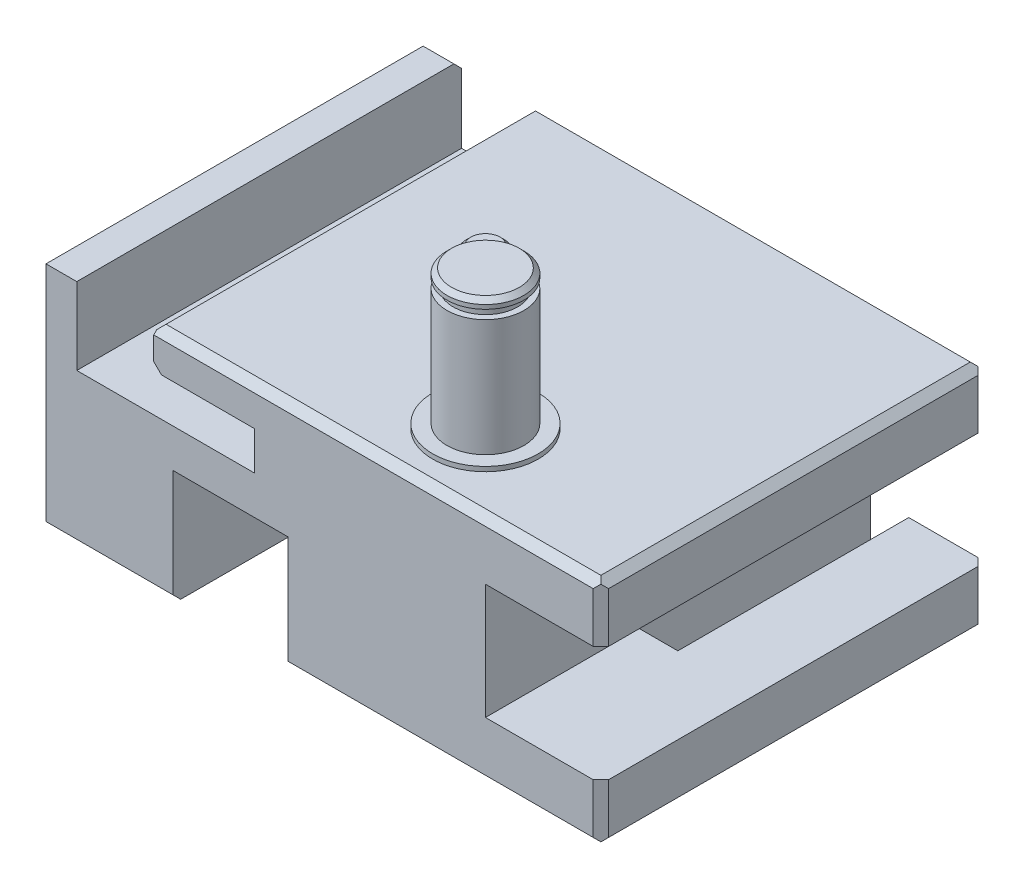
from build123d import *

# Parameters (mm, degrees)
BOSS_EXTRUDE1_DEPTH  = 31.75
CUT_EXTRUDE2_DEPTH   = 57.92947648
CUT_EXTRUDE1_DEPTH   = 57.92947648
FILLET1_R            = 2.54
CHAMFER1_SIZE        = 0.635
SKETCH5_R            = 4.3561
BOSS_EXTRUDE3_DEPTH  = 0.381
SKETCH6_R            = 3.175
BOSS_EXTRUDE4_DEPTH  = 11.1125
CHAMFER7_SIZE        = 0.381
CUT_EXTRUDE3_DEPTH   = 57.92947648
SKETCH12_W           = 19.05
SKETCH12_H           = 19.05
BOSS_EXTRUDE9_DEPTH  = 31.75
CUT_EXTRUDE4_DEPTH   = 62.733039651
CHAMFER6_SIZE        = 0.635
SKETCH16_W           = 1.016
SKETCH16_H           = 0.7366
SKETCH7_R            = 1.5875
BOSS_EXTRUDE11_DEPTH = 6.35
CHAMFER9_SIZE        = 0.381
SKETCH18_W           = 3.81
SKETCH18_H           = 3.81
BOSS_EXTRUDE12_DEPTH = 12.7
BOSS_EXTRUDE13_DEPTH = 0.635
CHAMFER10_SIZE       = 0.889
CHAMFER10_SIZE2      = 0.622484501
SKETCH20_W           = 3.175
SKETCH20_H           = 19.05
BOSS_EXTRUDE14_DEPTH = 31.75


with BuildPart() as part:
    # Sketch1 → Boss-Extrude1 (new body)
    with BuildSketch(Plane.XY):
        Polygon((0, 0), (7.9375, 0), (7.9375, 6.35), (4.7498, 6.35), (4.7498, 9.525), (20.6248, 9.525), (20.6248, 6.35), (17.4371, 6.35), (17.4371, 0), (43.2435, 0), (43.2435, 19.05), (0, 19.05), align=None)
    extrude(amount=BOSS_EXTRUDE1_DEPTH)

    # Sketch3 → Cut-Extrude2 (cut, through all)
    with BuildSketch(Plane.XY):
        Polygon((6.35, 15.875), (14.6685, 15.875), (14.6685, 12.7), (0, 12.7), (0, 19.05), (6.35, 19.05), align=None)
    extrude(amount=CUT_EXTRUDE2_DEPTH, mode=Mode.SUBTRACT)

    # Sketch2 → Cut-Extrude1 (cut, through all)
    with BuildSketch(Plane.XY):
        Polygon((25.3873, 0), (43.2435, 9.525), (43.2435, 0), align=None)
    extrude(amount=CUT_EXTRUDE1_DEPTH, mode=Mode.SUBTRACT)

    # Fillet1
    fillet1_edges = [part.edges().sort_by_distance(p)[0] for p in [
        (43.2435, 19.05, 15.875),
        (25.3873, 0, 15.875),
        (43.2435, 9.525, 15.875),
    ]]
    fillet(fillet1_edges, radius=FILLET1_R)

    # Chamfer1
    chamfer1_edges = [part.edges().sort_by_distance(p)[0] for p in [
        (6.35, 15.875, 15.875),
    ]]
    chamfer(chamfer1_edges, length=CHAMFER1_SIZE)

    # Sketch5 → Boss-Extrude3 (add)
    with BuildSketch(Plane(origin=(0, 19.05, 0), x_dir=(1, 0, 0), z_dir=(0, 1, 0))):
        with Locations(Location((27.3685, -25.4, 0), (0, 0, 90))):
            Circle(SKETCH5_R)
    extrude(amount=BOSS_EXTRUDE3_DEPTH)

    # Sketch6 → Boss-Extrude4 (add)
    with BuildSketch(Plane(origin=(0, 19.431, 0), x_dir=(1, 0, 0), z_dir=(0, 1, 0))):
        with Locations(Location((27.3685, -25.4, 0), (0, 0, 270))):
            Circle(SKETCH6_R)
    extrude(amount=BOSS_EXTRUDE4_DEPTH)

    # Chamfer7
    chamfer7_edges = [part.edges().sort_by_distance(p)[0] for p in [
        (6.35, 19.05, 15.875),
        (27.3685, 30.5435, 22.225),
    ]]
    chamfer(chamfer7_edges, length=CHAMFER7_SIZE)

    # Sketch9 → Cut-Extrude3 (cut, through all)
    with BuildSketch(Plane(origin=(0, 19.05, 0), x_dir=(1, 0, 0), z_dir=(0, 1, 0))):
        Polygon((27.3685, 0), (43.2435, -19.05), (43.2435, 0), align=None)
    extrude(amount=-CUT_EXTRUDE3_DEPTH, mode=Mode.SUBTRACT)

    # Sketch12 → Boss-Extrude9 (add, through all)
    with BuildSketch(Plane.XY):
        with Locations((33.7185, 9.525)):
            Rectangle(SKETCH12_W, SKETCH12_H)
    extrude(amount=BOSS_EXTRUDE9_DEPTH)

    # Sketch13 → Cut-Extrude4 (cut, through all)
    with BuildSketch(Plane.XY):
        Polygon((43.2435, 14.2875), (36.8935, 14.2875), (36.8935, 17.4625), (33.7185, 17.4625), (33.7185, 1.5875), (36.8935, 1.5875), (36.8935, 4.7625), (43.2435, 4.7625), align=None)
    extrude(amount=CUT_EXTRUDE4_DEPTH, mode=Mode.SUBTRACT)

    # Chamfer6
    chamfer6_edges = [part.edges().sort_by_distance(p)[0] for p in [
        (43.2435, 19.05, 15.875),
        (43.2435, 0, 15.875),
        (43.2435, 2.38125, 0),
        (43.2435, 16.66875, 0),
    ]]
    chamfer(chamfer6_edges, length=CHAMFER6_SIZE)

    # Sketch16 → Cut-Revolve1 (revolve, cut)
    with BuildSketch(Plane.XY.offset(25.4), mode=Mode.PRIVATE) as cut_revolve1_sk:
        with Locations((24.1935, 29.4513)):
            Rectangle(SKETCH16_W, SKETCH16_H)
    revolve(cut_revolve1_sk.sketch.rotate(Axis((27.3685, 30.1625, 25.4), (0, 1, 0)), 270), axis=Axis((27.3685, 30.1625, 25.4), (0, 1, 0)), mode=Mode.SUBTRACT)

    # Sketch7 → Boss-Extrude11 (add)
    with BuildSketch(Plane(origin=(0, 19.05, 0), x_dir=(1, 0, 0), z_dir=(0, 1, 0))):
        with Locations(Location((20.633307909, -18.664807909, 0), (0, 0, 90))):
            Circle(SKETCH7_R)
    extrude(amount=BOSS_EXTRUDE11_DEPTH)

    # Chamfer9
    chamfer9_edges = [part.edges().sort_by_distance(p)[0] for p in [
        (20.633307909, 19.05, 20.252307909),
        (20.633307909, 25.4, 20.252307909),
    ]]
    chamfer(chamfer9_edges, length=CHAMFER9_SIZE)

    # Sketch18 → Boss-Extrude12 (add)
    with BuildSketch(Plane.XY.offset(31.75)):
        with Locations((6.0325, 8.001)):
            Rectangle(SKETCH18_W, SKETCH18_H)
        with Locations((19.3421, 8.001)):
            Rectangle(SKETCH18_W, SKETCH18_H)
        with Locations((35.3695, 2.8575)):
            Rectangle(SKETCH18_W, SKETCH18_H)
        with Locations((35.3695, 16.1925)):
            Rectangle(SKETCH18_W, SKETCH18_H)
    extrude(amount=-BOSS_EXTRUDE12_DEPTH)

    # Sketch19 → Boss-Extrude13 (add)
    with BuildSketch(Plane(origin=(0, 12.7, 0), x_dir=(1, 0, 0), z_dir=(0, 1, 0))):
        with BuildLine():
            Line((7.1755, -22.098), (10.2235, -22.098))
            ThreePointArc((10.2235, -22.098), (8.6995, -23.622), (7.1755, -22.098))
        make_face()
    extrude(amount=BOSS_EXTRUDE13_DEPTH)

    # Chamfer10
    chamfer10_edges = [part.edges().sort_by_distance(p)[0] for p in [
        (8.6995, 12.7, 22.098),
    ]]
    chamfer10_side = [part.faces().sort_by_distance(p)[0] for p in [
        (7.323470763, 12.7, 15.820759922),
    ]]
    chamfer(chamfer10_edges, length=CHAMFER10_SIZE, length2=CHAMFER10_SIZE2, reference=chamfer10_side[0])

    # Sketch20 → Boss-Extrude14 (add)
    with BuildSketch(Plane.XY.offset(31.75)):
        with Locations((-1.5875, 9.525)):
            Rectangle(SKETCH20_W, SKETCH20_H)
    extrude(amount=-BOSS_EXTRUDE14_DEPTH)

    # Chamfer11
    # the kernel refuses this chamfer: 0.635 mm, written as the material it takes off along each edge
    with BuildSketch(Plane(origin=(-2.751666667, 18.626666667, 0.423333333), x_dir=(-0.7071067811865465, -0.7071067811865485, 0), z_dir=(-0.5773502691896266, 0.577350269189625, -0.5773502691896257)), Plane(origin=(-2.751666667, 0.423333333, 0.423333333), x_dir=(-0.707106781186547, 0, 0.707106781186548), z_dir=(-0.5773502691896263, -0.5773502691896252, -0.5773502691896257))) as chamfer11_piece_1:
        Polygon((-0.449012806, 0.259237664), (0.449012806, 0.259237664), (0, -0.518475329), align=None)
    extrude(amount=0.806558326, mode=Mode.SUBTRACT)
    with BuildSketch(Plane(origin=(-2.751666667, 0.423333333, 31.326666667), x_dir=(-0.707106781186547, 0, -0.707106781186548), z_dir=(-0.5773502691896258, -0.5773502691896262, 0.5773502691896253))) as chamfer11_piece_2:
        Polygon((-0.449012806, -0.259237664), (0.449012806, -0.259237664), (0, 0.518475329), align=None)
    extrude(amount=0.806558326, mode=Mode.SUBTRACT)
    with BuildSketch(Plane(origin=(-3.175, 19.05, 33.383018697), x_dir=(0.9996219169112968, 0.027495876610584568, 0), z_dir=(0, 0, -1)), Plane(origin=(-3.175, 0, 33.383018697), x_dir=(-0.027495876610586605, 0.9996219169112968, 0), z_dir=(0, 0, -1))) as chamfer11_piece_3:
        with BuildLine():
            Line((0.653207479, 0), (-0.035907443, 0.652219799))
            Line((-0.035907443, 0.652219799), (-0.048602642, 0.651870601))
            ThreePointArc((-0.048602642, 0.651870601), (-0.021672059, 0.326007622), (-0.012695198, -0.000349198))
            Line((-0.012695198, -0.000349198), (0.000349198, -0.012695198))
            ThreePointArc((0.000349198, -0.012695198), (0.326706017, -0.003718338), (0.653556677, -0.012695198))
            Line((0.653556677, -0.012695198), (0.653207479, 0))
        make_face()
    extrude(amount=35.016037395, mode=Mode.SUBTRACT)
    with BuildSketch(Plane(origin=(5.097981303, 19.05, 0), x_dir=(0, 0.027495876610584568, 0.9996219169112968), z_dir=(1, 0, 0))) as chamfer11_piece_4:
        with BuildLine():
            Line((0.653207479, 0), (-0.035907443, 0.652219799))
            Line((-0.035907443, 0.652219799), (-0.048602642, 0.651870601))
            ThreePointArc((-0.048602642, 0.651870601), (-0.021672059, 0.326007622), (-0.012695198, -0.000349198))
            Line((-0.012695198, -0.000349198), (0.000349198, -0.012695198))
            ThreePointArc((0.000349198, -0.012695198), (0.326706017, -0.003718338), (0.653556677, -0.012695198))
            Line((0.653556677, -0.012695198), (0.653207479, 0))
        make_face()
    extrude(amount=39.143537395, mode=Mode.SUBTRACT)
    with BuildSketch(Plane(origin=(44.241518697, 0, 0), x_dir=(0, -0.027495876610586365, 0.9996219169112968), z_dir=(-1, 0, 0))) as chamfer11_piece_5:
        with BuildLine():
            Line((0.653207479, 0), (-0.035907443, 0.652219799))
            Line((-0.035907443, 0.652219799), (-0.048602642, 0.651870601))
            ThreePointArc((-0.048602642, 0.651870601), (-0.021672059, 0.326007622), (-0.012695198, -0.000349198))
            Line((-0.012695198, -0.000349198), (0.000349198, -0.012695198))
            ThreePointArc((0.000349198, -0.012695198), (0.326706017, -0.003718338), (0.653556677, -0.012695198))
            Line((0.653556677, -0.012695198), (0.653207479, 0))
        make_face()
    extrude(amount=28.437437395, mode=Mode.SUBTRACT)
    with BuildSketch(Plane(origin=(44.241518697, 0, 31.75), x_dir=(0, -0.02749587661058632, -0.9996219169112968), z_dir=(-1, 0, 0))) as chamfer11_piece_6:
        with BuildLine():
            Line((0.653207479, 0), (-0.035907443, -0.652219799))
            Line((-0.035907443, -0.652219799), (-0.048602642, -0.651870601))
            ThreePointArc((-0.048602642, -0.651870601), (-0.021672059, -0.326007622), (-0.012695198, 0.000349198))
            Line((-0.012695198, 0.000349198), (0.000349198, 0.012695198))
            ThreePointArc((0.000349198, 0.012695198), (0.326706017, 0.003718338), (0.653556677, 0.012695198))
            Line((0.653556677, 0.012695198), (0.653207479, 0))
        make_face()
    extrude(amount=28.437437395, mode=Mode.SUBTRACT)
    with BuildSketch(Plane(origin=(5.097981303, 19.05, 31.75), x_dir=(0, 0.02749587661058455, -0.9996219169112968), z_dir=(1, 0, 0))) as chamfer11_piece_7:
        with BuildLine():
            Line((0.653207479, 0), (-0.035907443, -0.652219799))
            Line((-0.035907443, -0.652219799), (-0.048602642, -0.651870601))
            ThreePointArc((-0.048602642, -0.651870601), (-0.021672059, -0.326007622), (-0.012695198, 0.000349198))
            Line((-0.012695198, 0.000349198), (0.000349198, 0.012695198))
            ThreePointArc((0.000349198, 0.012695198), (0.326706017, 0.003718338), (0.653556677, 0.012695198))
            Line((0.653556677, 0.012695198), (0.653207479, 0))
        make_face()
    extrude(amount=39.143537395, mode=Mode.SUBTRACT)
    with BuildSketch(Plane(origin=(-4.808018697, 19.05, 0), x_dir=(0, 0.0274958766105845, 0.9996219169112968), z_dir=(1, 0, 0))) as chamfer11_piece_8:
        with BuildLine():
            Line((0.653207479, 0), (-0.035907443, 0.652219799))
            Line((-0.035907443, 0.652219799), (-0.048602642, 0.651870601))
            ThreePointArc((-0.048602642, 0.651870601), (-0.021672059, 0.326007622), (-0.012695198, -0.000349198))
            Line((-0.012695198, -0.000349198), (0.000349198, -0.012695198))
            ThreePointArc((0.000349198, -0.012695198), (0.326706017, -0.003718338), (0.653556677, -0.012695198))
            Line((0.653556677, -0.012695198), (0.653207479, 0))
        make_face()
    extrude(amount=6.441037395, mode=Mode.SUBTRACT)
    with BuildSketch(Plane(origin=(9.570518697, 0, 0), x_dir=(0, -0.027495876610586365, 0.9996219169112968), z_dir=(-1, 0, 0)), Plane(origin=(-4.808018697, 0, 31.75), x_dir=(0, -0.02749587661058632, -0.9996219169112968), z_dir=(1, 0, 0))) as chamfer11_piece_9:
        with BuildLine():
            Line((0.653207479, 0), (-0.035907443, 0.652219799))
            Line((-0.035907443, 0.652219799), (-0.048602642, 0.651870601))
            ThreePointArc((-0.048602642, 0.651870601), (-0.021672059, 0.326007622), (-0.012695198, -0.000349198))
            Line((-0.012695198, -0.000349198), (0.000349198, -0.012695198))
            ThreePointArc((0.000349198, -0.012695198), (0.326706017, -0.003718338), (0.653556677, -0.012695198))
            Line((0.653556677, -0.012695198), (0.653207479, 0))
        make_face()
    extrude(amount=14.378537395, mode=Mode.SUBTRACT)
    with BuildSketch(Plane(origin=(43.2435, -0.998018697, 31.75), x_dir=(0.027495876610589984, 0, -0.9996219169112966), z_dir=(0, 1, 0)), Plane(origin=(43.2435, 12.654481303, 31.75), x_dir=(0.027495876610589984, 0, -0.9996219169112966), z_dir=(0, 1, 0))) as chamfer11_piece_10:
        with BuildLine():
            Line((0.653207479, 0), (-0.035907443, 0.652219799))
            Line((-0.035907443, 0.652219799), (-0.048602642, 0.651870601))
            ThreePointArc((-0.048602642, 0.651870601), (-0.021672059, 0.326007622), (-0.012695198, -0.000349198))
            Line((-0.012695198, -0.000349198), (0.000349198, -0.012695198))
            ThreePointArc((0.000349198, -0.012695198), (0.326706017, -0.003718338), (0.653556677, -0.012695198))
            Line((0.653556677, -0.012695198), (0.653207479, 0))
        make_face()
    extrude(amount=7.393537395, mode=Mode.SUBTRACT)
    with BuildSketch(Plane(origin=(-3.175, -1.633018697, 0), x_dir=(-0.02749587661058654, 0, 0.9996219169112968), z_dir=(0, 1, 0))) as chamfer11_piece_11:
        with BuildLine():
            Line((0.653207479, 0), (-0.035907443, 0.652219799))
            Line((-0.035907443, 0.652219799), (-0.048602642, 0.651870601))
            ThreePointArc((-0.048602642, 0.651870601), (-0.021672059, 0.326007622), (-0.012695198, -0.000349198))
            Line((-0.012695198, -0.000349198), (0.000349198, -0.012695198))
            ThreePointArc((0.000349198, -0.012695198), (0.326706017, -0.003718338), (0.653556677, -0.012695198))
            Line((0.653556677, -0.012695198), (0.653207479, 0))
        make_face()
    extrude(amount=22.316037395, mode=Mode.SUBTRACT)
    with BuildSketch(Plane(origin=(-3.175, -1.633018697, 31.75), x_dir=(-0.02749587661058659, 0, -0.9996219169112968), z_dir=(0, 1, 0))) as chamfer11_piece_12:
        with BuildLine():
            Line((0.653207479, 0), (-0.035907443, -0.652219799))
            Line((-0.035907443, -0.652219799), (-0.048602642, -0.651870601))
            ThreePointArc((-0.048602642, -0.651870601), (-0.021672059, -0.326007622), (-0.012695198, 0.000349198))
            Line((-0.012695198, 0.000349198), (0.000349198, 0.012695198))
            ThreePointArc((0.000349198, 0.012695198), (0.326706017, 0.003718338), (0.653556677, 0.012695198))
            Line((0.653556677, 0.012695198), (0.653207479, 0))
        make_face()
    extrude(amount=22.316037395, mode=Mode.SUBTRACT)


solid = part.part
